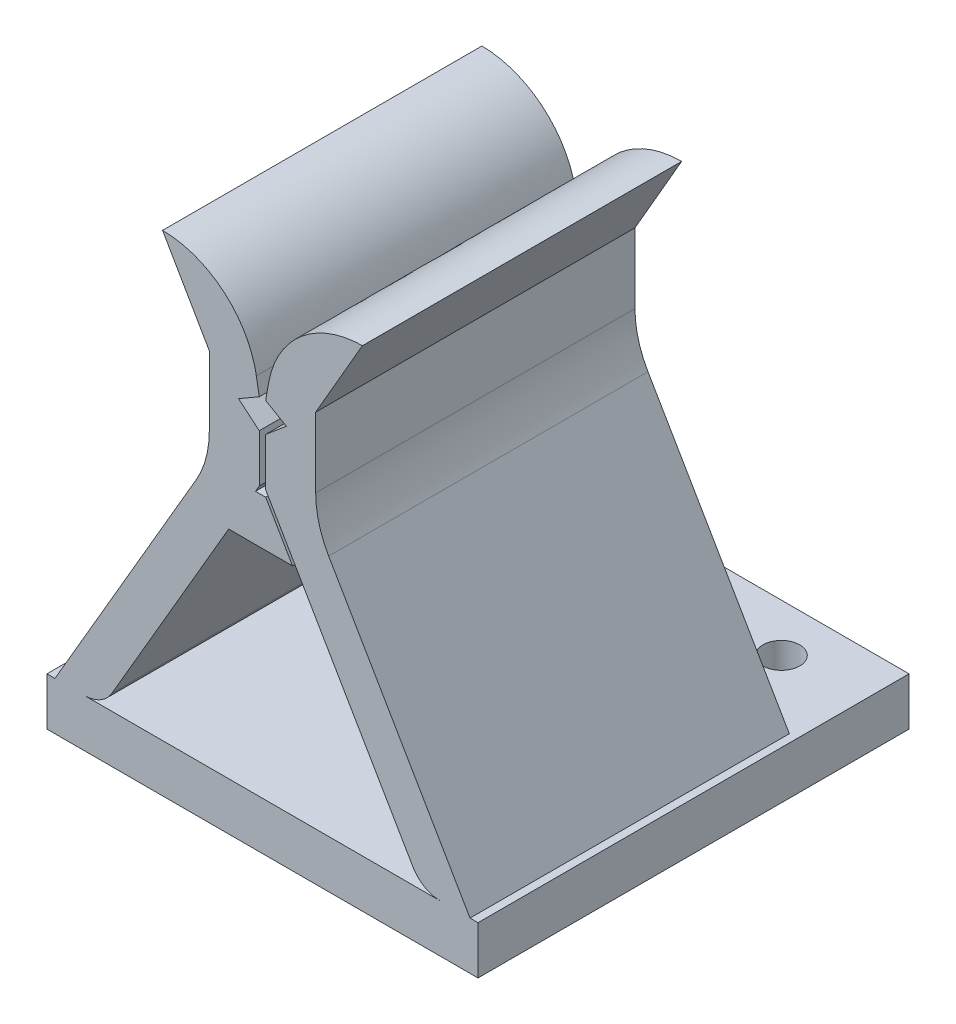
from build123d import *

# Parameters (mm, degrees)
SCHIZZO1_W                     = 50
SCHIZZO1_H                     = 3
ESTRUSIONE_ESTRUSIONE1_DEPTH   = 20
ESTRUSIONE_ESTRUSIONE2_DEPTH   = 20
ESTRUSIONE_ESTRUSIONE2_2_DEPTH = 20
RACCORDO2_R                    = 6
RACCORDO3_DEPTH                = 20
RACCORDO4_R                    = 6
RACCORDO5_R                    = 6
RACCORDO7_R                    = 2
RACCORDO8_R                    = 2
SCHIZZO5_W                     = 11.5
SCHIZZO5_H                     = 20
TAGLIO_ESTRUSIONE2_DEPTH       = 3
ESTRUSIONE_ESTRUSIONE7_DEPTH   = 20
SCHIZZO12_W                    = 27
SCHIZZO12_H                    = 7
SCHIZZO12_R                    = 1.15
ESTRUSIONE_ESTRUSIONE9_DEPTH   = 3


with BuildPart() as part:
    # Schizzo1 → Estrusione-Estrusione1 (new body)
    with BuildSketch(Plane.XY):
        with Locations((25, 1.5)):
            Rectangle(SCHIZZO1_W, SCHIZZO1_H)
    extrude(amount=ESTRUSIONE_ESTRUSIONE1_DEPTH)

    # Schizzo5 → Taglio-Estrusione2 (cut)
    with BuildSketch(Plane(origin=(0, 3, 0), x_dir=(1, 0, 0), z_dir=(0, 1, 0))):
        with Locations((5.75, -10)):
            Rectangle(SCHIZZO5_W, SCHIZZO5_H)
        with Locations((44.25, -10)):
            Rectangle(SCHIZZO5_W, SCHIZZO5_H)
    extrude(amount=-TAGLIO_ESTRUSIONE2_DEPTH, mode=Mode.SUBTRACT)



with BuildPart() as body_2:
    # Schizzo2 → Estrusione-Estrusione2 (new body)
    with BuildSketch(Plane.XY.offset(20)):
        Polygon((12, 3), (21.667680152, 19.610006491), (21.667680152, 25.610006491), (18.742038116, 30.677367142), (23.742038116, 30.677367142), (24.8, 24.677367142), (23.500961894, 23.927367142), (24.8, 22.837344747), (24.8, 19.837344747), (15, 3), align=None)
    extrude(amount=-ESTRUSIONE_ESTRUSIONE2_DEPTH)

    # Raccordo2
    # the kernel refuses this fillet: 6 mm, written as the material it takes off along each edge
    with BuildSketch(Plane(origin=(23.742038116, 30.677367142, 32.586494468), x_dir=(-1, 0, 0), z_dir=(0, 0, -1))) as raccordo2_piece_1:
        with BuildLine():
            CenterArc((RACCORDO2_R * 0.839099631177, -RACCORDO2_R), RACCORDO2_R, 90, 80)
            Line((-RACCORDO2_R * 0.145708121835, -RACCORDO2_R * 0.826351822333), (0, 0))
            Line((0, 0), (RACCORDO2_R * 0.839099631177, 0))
        make_face()
    extrude(amount=45.172988935, mode=Mode.SUBTRACT)

    # Raccordo5
    raccordo5_edges = [body_2.edges().sort_by_distance(p)[0] for p in [
        (21.667680152, 19.610006491, 10),
    ]]
    fillet(raccordo5_edges, radius=RACCORDO5_R)

    # Raccordo8
    raccordo8_edges = [body_2.edges().sort_by_distance(p)[0] for p in [
        (15, 3, 10),
    ]]
    fillet(raccordo8_edges, radius=RACCORDO8_R)

    # Schizzo9 → Estrusione-Estrusione7 (add)
    with BuildSketch(Plane.XY.offset(20)):
        Polygon((24.564100135, 19.432046037), (22.884294771, 16.545978484), (26.884294771, 16.545978484), (25.204489408, 19.432046037), align=None)
    extrude(amount=-ESTRUSIONE_ESTRUSIONE7_DEPTH)


with BuildPart() as body_3:
    # Schizzo2 → Estrusione-Estrusione2 2 (new body)
    with BuildSketch(Plane.XY.offset(20)):
        Polygon((26.499038106, 23.927367142), (25.2, 22.837344747), (25.2, 19.837344747), (35, 3), (38, 3), (28.332319848, 19.610006491), (28.332319848, 25.610006491), (31.257961884, 30.677367142), (26.257961884, 30.677367142), (25.2, 24.677367142), align=None)
    extrude(amount=-ESTRUSIONE_ESTRUSIONE2_2_DEPTH)

    # Raccordo3: read off the stored shape, not the designer's step
    # Raccordo3 outline → Raccordo3 (cut)
    with BuildSketch(Plane.XY):
        with BuildLine():
            add(Edge.make_bspline(
                [(31.257961884, 30.677367142), (26.252870263, 30.648491125), (25.38373076, 25.719356061)],
                knots=[0, 0, 0, 1, 1, 1], degree=2, weights=[1, 0.767895459, 1]))
            Line((31.257961884, 30.677367142), (26.257961884, 30.677367142))
            Line((26.257961884, 30.677367142), (25.38373076, 25.719356061))
        make_face()
    extrude(amount=RACCORDO3_DEPTH, mode=Mode.SUBTRACT)

    # Raccordo4
    raccordo4_edges = [body_3.edges().sort_by_distance(p)[0] for p in [
        (28.332319848, 19.610006491, 10),
    ]]
    fillet(raccordo4_edges, radius=RACCORDO4_R)

    # Raccordo7
    raccordo7_edges = [body_3.edges().sort_by_distance(p)[0] for p in [
        (35, 3, 10),
    ]]
    fillet(raccordo7_edges, radius=RACCORDO7_R)


with BuildPart() as part_1:
    add(part.part)

    add(body_2.part)  # Estrusione-Estrusione9 merges body 2

    add(body_3.part)  # Estrusione-Estrusione9 merges body 3
    # Schizzo12 → Estrusione-Estrusione9 (add)
    with BuildSketch(Plane(origin=(0, 3, 0), x_dir=(1, 0, 0), z_dir=(0, 1, 0))):
        with Locations((25, 3.5)):
            Rectangle(SCHIZZO12_W, SCHIZZO12_H)
        with Locations(Location((16.5, 4, 0), (0, 0, 270))):
            Circle(SCHIZZO12_R, mode=Mode.SUBTRACT)
        with Locations(Location((33.5, 4, 0), (0, 0, 270))):
            Circle(SCHIZZO12_R, mode=Mode.SUBTRACT)
    extrude(amount=-ESTRUSIONE_ESTRUSIONE9_DEPTH)


solid = part_1.part
